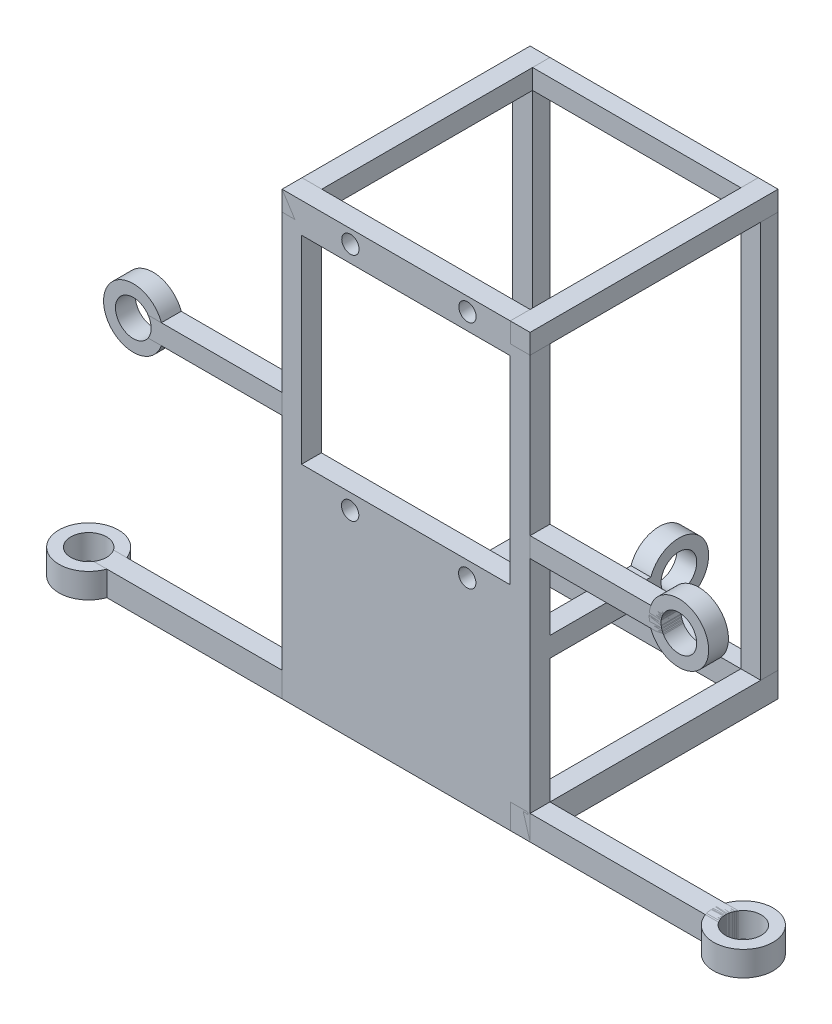
from build123d import *

# Parameters (mm, degrees)
SKETCH114_W             = 3.5
SKETCH114_H             = 80
BOSS_EXTRUDE2_DEPTH     = 4
SKETCH115_W             = 50
SKETCH115_H             = 3.5
BOSS_EXTRUDE3_DEPTH     = 4
SKETCH116_W             = 3.5
SKETCH116_H             = 80
BOSS_EXTRUDE5_DEPTH     = 4
SKETCH117_W             = 50
SKETCH117_H             = 3.5
BOSS_EXTRUDE6_DEPTH     = 5
SKETCH119_W             = 50
SKETCH119_H             = 5
BOSS_EXTRUDE7_DEPTH     = 4
SKETCH119_H_2           = 4
BOSS_EXTRUDE7_2_DEPTH   = 4
SKETCH122_W             = 50
SKETCH122_H             = 4
BOSS_EXTRUDE8_DEPTH     = 4
SKETCH122_H_2           = 5
BOSS_EXTRUDE8_2_DEPTH   = 4
SKETCH134_W             = 50
SKETCH134_H             = 89
BOSS_EXTRUDE18_DEPTH    = 4
SKETCH135_W             = 45
SKETCH135_H             = 4
BOSS_EXTRUDE19_DEPTH    = 5
SKETCH136_W             = 45
SKETCH136_H             = 4
BOSS_EXTRUDE21_DEPTH    = 5
SKETCH137_R             = 6
BOSS_EXTRUDE22_DEPTH    = 5
CUT_EXTRUDE1_DEPTH      = 10
CUT_EXTRUDE1_DEPTH_BACK = 38
SKETCH139_R             = 3.6
SKETCH140_R             = 6
BOSS_EXTRUDE23_DEPTH    = 5
CUT_EXTRUDE2_DEPTH      = 29
CUT_EXTRUDE2_DEPTH_BACK = 17
SKETCH143_R             = 3.6
SKETCH145_W             = 30
SKETCH145_H             = 4
BOSS_EXTRUDE26_DEPTH    = 4
SKETCH146_R             = 6
BOSS_EXTRUDE27_DEPTH    = 4
CUT_EXTRUDE3_DEPTH      = 11
CUT_EXTRUDE3_DEPTH_BACK = 21
SKETCH147_R             = 3.6
SKETCH148_W             = 30
SKETCH148_H             = 4
BOSS_EXTRUDE28_DEPTH    = 4
SKETCH149_R             = 6
BOSS_EXTRUDE29_DEPTH    = 4
CUT_EXTRUDE4_DEPTH      = 12
CUT_EXTRUDE4_DEPTH_BACK = 14
SKETCH150_R             = 3.6
SKETCH156_W             = 42
SKETCH156_H             = 78
CUT_EXTRUDE8_DEPTH      = 4
SKETCH159_W             = 30
SKETCH159_H             = 4
BOSS_EXTRUDE31_DEPTH    = 4
SKETCH160_R             = 6
BOSS_EXTRUDE32_DEPTH    = 4
SKETCH161_R             = 3.6
CUT_EXTRUDE10_DEPTH     = 4
SKETCH162_W             = 42
SKETCH162_H             = 42.813081775
BOSS_EXTRUDE34_DEPTH    = 4
SKETCH164_R             = 1.75
CUT_EXTRUDE12_DEPTH     = 4


with BuildPart() as part:
    # Sketch114 → Boss-Extrude2 (new body)
    with BuildSketch(Plane(origin=(0, 0, 0), x_dir=(0, 0, -1), z_dir=(1, 0, 0))):
        with Locations((1.75, 40)):
            Rectangle(SKETCH114_W, SKETCH114_H)
    extrude(amount=BOSS_EXTRUDE2_DEPTH)


with BuildPart() as body_2:
    # Sketch115 → Boss-Extrude3 (new body)
    with BuildSketch(Plane(origin=(0, 80, 0), x_dir=(1, 0, 0), z_dir=(0, 1, 0))):
        with Locations((25, 1.75)):
            Rectangle(SKETCH115_W, SKETCH115_H)
    extrude(amount=BOSS_EXTRUDE3_DEPTH)


with BuildPart() as body_3:
    # Sketch116 → Boss-Extrude5 (new body)
    with BuildSketch(Plane(origin=(50, 0, 0), x_dir=(0, 0, -1), z_dir=(1, 0, 0))):
        with Locations((1.75, 40)):
            Rectangle(SKETCH116_W, SKETCH116_H)
    extrude(amount=-BOSS_EXTRUDE5_DEPTH)


with BuildPart() as body_4:
    # Sketch117 → Boss-Extrude6 (new body)
    with BuildSketch(Plane.XZ):
        with Locations((25, -1.75)):
            Rectangle(SKETCH117_W, SKETCH117_H)
    extrude(amount=BOSS_EXTRUDE6_DEPTH)


with BuildPart() as body_5:
    # Sketch119 → Boss-Extrude7 (new body)
    with BuildSketch(Plane(origin=(50, 0, 0), x_dir=(0, 0, -1), z_dir=(1, 0, 0))):
        with Locations((-21.5, -2.5)):
            Rectangle(SKETCH119_W, SKETCH119_H)
    extrude(amount=-BOSS_EXTRUDE7_DEPTH)


with BuildPart() as body_6:
    # Sketch119 → Boss-Extrude7 2 (new body)
    with BuildSketch(Plane(origin=(50, 0, 0), x_dir=(0, 0, -1), z_dir=(1, 0, 0))):
        with Locations((-21.5, 82)):
            Rectangle(SKETCH119_W, SKETCH119_H_2)
    extrude(amount=-BOSS_EXTRUDE7_2_DEPTH)


with BuildPart() as body_7:
    # Sketch122 → Boss-Extrude8 (new body)
    with BuildSketch(Plane.ZY):
        with Locations((21.5, 82)):
            Rectangle(SKETCH122_W, SKETCH122_H)
    extrude(amount=-BOSS_EXTRUDE8_DEPTH)


with BuildPart() as body_8:
    # Sketch122 → Boss-Extrude8 2 (new body)
    with BuildSketch(Plane.ZY):
        with Locations((21.5, -2.5)):
            Rectangle(SKETCH122_W, SKETCH122_H_2)
    extrude(amount=-BOSS_EXTRUDE8_2_DEPTH)


with BuildPart() as body_9:
    # Sketch134 → Boss-Extrude18 (new body)
    with BuildSketch(Plane.XY.offset(46.5)):
        with Locations((25, 39.5)):
            Rectangle(SKETCH134_W, SKETCH134_H)
    extrude(amount=-BOSS_EXTRUDE18_DEPTH)


with BuildPart() as body_10:
    # Sketch135 → Boss-Extrude19 (new body)
    with BuildSketch(Plane(origin=(0, -5, 0), x_dir=(-1, 0, 0), z_dir=(0, -1, 0))):
        with Locations((-68.5, -44.5)):
            Rectangle(SKETCH135_W, SKETCH135_H)
    extrude(amount=-BOSS_EXTRUDE19_DEPTH)


with BuildPart() as body_11:
    # Sketch136 → Boss-Extrude21 (new body)
    with BuildSketch(Plane.XZ.offset(5)):
        with Locations((-18.5, 44.5)):
            Rectangle(SKETCH136_W, SKETCH136_H)
    extrude(amount=-BOSS_EXTRUDE21_DEPTH)


with BuildPart() as body_12:
    # Sketch137 → Boss-Extrude22 (new body)
    with BuildSketch(Plane.XZ.offset(5)):
        with Locations((91, 44.5)):
            Circle(SKETCH137_R)
    extrude(amount=-BOSS_EXTRUDE22_DEPTH)


with BuildPart() as cut_extrude1_tool:
    # Sketch139 → Cut-Extrude1 (new, two sides: drawn at the far end of the back side and taken through both)
    with BuildSketch(Plane(origin=(0, -5, 0), x_dir=(-1, 0, 0), z_dir=(0, -1, 0)).offset(-CUT_EXTRUDE1_DEPTH_BACK)):
        with Locations((-91, -44.5)):
            Circle(SKETCH139_R)
    extrude(amount=CUT_EXTRUDE1_DEPTH + CUT_EXTRUDE1_DEPTH_BACK)


with BuildPart() as body_10_1:
    add(body_10.part)

    # Cut-Extrude1: cut by cut_extrude1_tool
    add(cut_extrude1_tool.part, mode=Mode.SUBTRACT)


with BuildPart() as body_12_1:
    add(body_12.part)

    # Cut-Extrude1: cut by cut_extrude1_tool
    add(cut_extrude1_tool.part, mode=Mode.SUBTRACT)


with BuildPart() as body_13:
    # Sketch140 → Boss-Extrude23 (new body)
    with BuildSketch(Plane.XZ.offset(5)):
        with Locations((-41, 44.5)):
            Circle(SKETCH140_R)
    extrude(amount=-BOSS_EXTRUDE23_DEPTH)


with BuildPart() as cut_extrude2_tool:
    # Sketch143 → Cut-Extrude2 (new, two sides: drawn at the far end of the back side and taken through both)
    with BuildSketch(Plane.XZ.offset(5).offset(-CUT_EXTRUDE2_DEPTH_BACK)):
        with Locations((-41, 44.5)):
            Circle(SKETCH143_R)
    extrude(amount=CUT_EXTRUDE2_DEPTH + CUT_EXTRUDE2_DEPTH_BACK)


with BuildPart() as body_11_1:
    add(body_11.part)

    # Cut-Extrude2: cut by cut_extrude2_tool
    add(cut_extrude2_tool.part, mode=Mode.SUBTRACT)


with BuildPart() as body_13_1:
    add(body_13.part)

    # Cut-Extrude2: cut by cut_extrude2_tool
    add(cut_extrude2_tool.part, mode=Mode.SUBTRACT)


with BuildPart() as body_14:
    # Sketch145 → Boss-Extrude26 (new body)
    with BuildSketch(Plane(origin=(0, 5, 42.5), x_dir=(-1, 0, 0), z_dir=(0, 0, -1))):
        with Locations((15, 41.5)):
            Rectangle(SKETCH145_W, SKETCH145_H)
    extrude(amount=-BOSS_EXTRUDE26_DEPTH)


with BuildPart() as body_15:
    # Sketch146 → Boss-Extrude27 (new body)
    with BuildSketch(Plane(origin=(0, 5, 46.5), x_dir=(1, 0, 0), z_dir=(0, 0, 1))):
        with Locations((-30, 41.5)):
            Circle(SKETCH146_R)
    extrude(amount=-BOSS_EXTRUDE27_DEPTH)


with BuildPart() as cut_extrude3_tool:
    # Sketch147 → Cut-Extrude3 (new, two sides: drawn at the far end of the back side and taken through both)
    with BuildSketch(Plane(origin=(0, 5, 46.5), x_dir=(1, 0, 0), z_dir=(0, 0, 1)).offset(-CUT_EXTRUDE3_DEPTH_BACK)):
        with Locations((-30, 41.5)):
            Circle(SKETCH147_R)
    extrude(amount=CUT_EXTRUDE3_DEPTH + CUT_EXTRUDE3_DEPTH_BACK)


with BuildPart() as body_14_1:
    add(body_14.part)

    # Cut-Extrude3: cut by cut_extrude3_tool
    add(cut_extrude3_tool.part, mode=Mode.SUBTRACT)


with BuildPart() as body_15_1:
    add(body_15.part)

    # Cut-Extrude3: cut by cut_extrude3_tool
    add(cut_extrude3_tool.part, mode=Mode.SUBTRACT)


with BuildPart() as body_16:
    # Sketch148 → Boss-Extrude28 (new body)
    with BuildSketch(Plane(origin=(0, 5, 46.5), x_dir=(1, 0, 0), z_dir=(0, 0, 1))):
        with Locations((65, 41.5)):
            Rectangle(SKETCH148_W, SKETCH148_H)
    extrude(amount=-BOSS_EXTRUDE28_DEPTH)


with BuildPart() as body_17:
    # Sketch149 → Boss-Extrude29 (new body)
    with BuildSketch(Plane(origin=(0, 5, 42.5), x_dir=(-1, 0, 0), z_dir=(0, 0, -1))):
        with Locations((-80, 41.5)):
            Circle(SKETCH149_R)
    extrude(amount=-BOSS_EXTRUDE29_DEPTH)


with BuildPart() as cut_extrude4_tool:
    # Sketch150 → Cut-Extrude4 (new, two sides: drawn at the far end of the back side and taken through both)
    with BuildSketch(Plane(origin=(0, 5, 46.5), x_dir=(1, 0, 0), z_dir=(0, 0, 1)).offset(-CUT_EXTRUDE4_DEPTH_BACK)):
        with Locations((80, 41.5)):
            Circle(SKETCH150_R)
    extrude(amount=CUT_EXTRUDE4_DEPTH + CUT_EXTRUDE4_DEPTH_BACK)


with BuildPart() as body_16_1:
    add(body_16.part)

    # Cut-Extrude4: cut by cut_extrude4_tool
    add(cut_extrude4_tool.part, mode=Mode.SUBTRACT)


with BuildPart() as body_17_1:
    add(body_17.part)

    # Cut-Extrude4: cut by cut_extrude4_tool
    add(cut_extrude4_tool.part, mode=Mode.SUBTRACT)


with BuildPart() as cut_extrude8_tool:
    # Sketch156 → Cut-Extrude8 (new body)
    with BuildSketch(Plane.XY.offset(46.5)):
        with Locations((24.914818012, 38.92021053)):
            Rectangle(SKETCH156_W, SKETCH156_H)
    extrude(amount=-CUT_EXTRUDE8_DEPTH)


with BuildPart() as body_8_1:
    add(body_8.part)

    # Cut-Extrude8: cut by cut_extrude8_tool
    add(cut_extrude8_tool.part, mode=Mode.SUBTRACT)


with BuildPart() as body_9_1:
    add(body_9.part)

    # Cut-Extrude8: cut by cut_extrude8_tool
    add(cut_extrude8_tool.part, mode=Mode.SUBTRACT)

    # Sketch159 → Boss-Extrude31 (add)
    with BuildSketch(Plane(origin=(50, 0, 0), x_dir=(0, 0, -1), z_dir=(1, 0, 0))):
        with Locations((-31.5, 27.085014073)):
            Rectangle(SKETCH159_W, SKETCH159_H)
    extrude(amount=-BOSS_EXTRUDE31_DEPTH)

    # Sketch160 → Boss-Extrude32 (add)
    with BuildSketch(Plane.ZY.offset(-46)):
        with Locations((16.5, 27.085014073)):
            Circle(SKETCH160_R)
    extrude(amount=-BOSS_EXTRUDE32_DEPTH)

    # Sketch161 → Cut-Extrude10 (cut)
    with BuildSketch(Plane(origin=(50, 0, 0), x_dir=(0, 0, -1), z_dir=(1, 0, 0))):
        with Locations((-16.5, 27.085014073)):
            Circle(SKETCH161_R)
    extrude(amount=-CUT_EXTRUDE10_DEPTH, mode=Mode.SUBTRACT)

    # Sketch162 → Boss-Extrude34 (add)
    with BuildSketch(Plane.XY.offset(46.5)):
        with Locations((24.914818012, 16.513669643)):
            Rectangle(SKETCH162_W, SKETCH162_H)
    extrude(amount=-BOSS_EXTRUDE34_DEPTH)

    # Sketch164 → Cut-Extrude12 (cut)
    with BuildSketch(Plane(origin=(0, 0, 42.5), x_dir=(-1, 0, 0), z_dir=(0, 0, -1))):
        with Locations((-13.771446852, 81.278551211)):
            Circle(SKETCH164_R)
        with Locations((-37.371446852, 81.278551211)):
            Circle(SKETCH164_R)
        with Locations((-37.321446148, 34.778551211)):
            Circle(SKETCH164_R)
        with Locations((-13.721446148, 34.778551211)):
            Circle(SKETCH164_R)
    extrude(amount=-CUT_EXTRUDE12_DEPTH, mode=Mode.SUBTRACT)


with BuildPart() as body_11_2:
    add(body_11_1.part)

    # Cut-Extrude8: cut by cut_extrude8_tool
    add(cut_extrude8_tool.part, mode=Mode.SUBTRACT)


solid = Compound([part.part, body_2.part, body_3.part, body_4.part, body_5.part, body_6.part, body_7.part, body_10_1.part, body_12_1.part, body_13_1.part, body_14_1.part, body_15_1.part, body_16_1.part, body_17_1.part, body_8_1.part, body_9_1.part, body_11_2.part])
